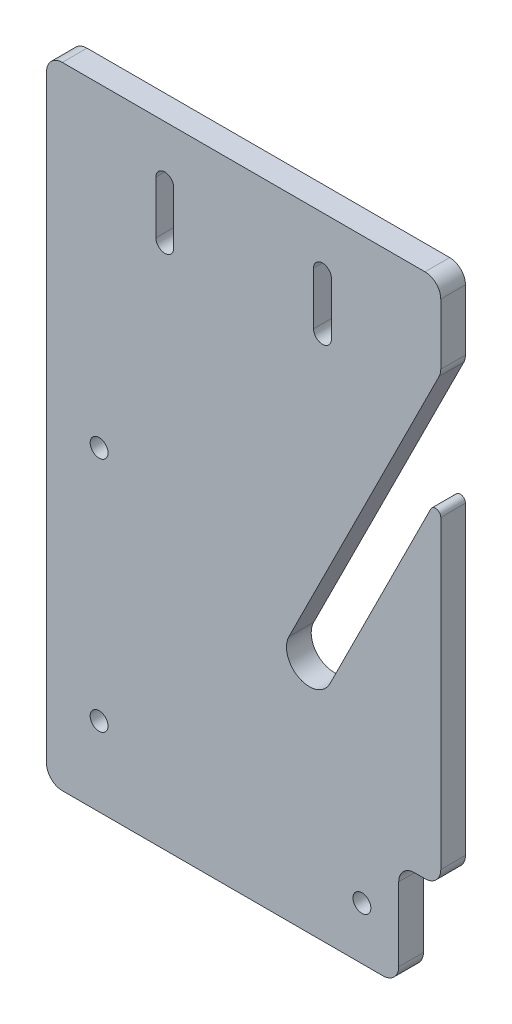
from build123d import *

# Parameters (mm, degrees)
SKETCH1_R           = 1.7
BOSS_EXTRUDE1_DEPTH = 4.7
FILLET1_R           = 3
CUT_EXTRUDE1_DEPTH  = 142.587746645
SKETCH3_W           = 8
SKETCH3_H           = 20
CUT_EXTRUDE2_DEPTH  = 142.587746645
FILLET2_R           = 3
FILLET3_R           = 1


with BuildPart() as part:
    # Sketch1 → Boss-Extrude1 (new body)
    with BuildSketch(Plane.XY):
        with BuildLine():
            Line((75, 0), (0, 0))
            Line((0, 0), (0, -120))
            Line((0, -120), (75, -120))
            Line((75, -120), (75, -34.726895702))
            Line((75, -34.726895702), (63.890758281, -56.94537914))
            Line((63.890758281, -56.94537914), (53.890758281, -76.94537914))
            ThreePointArc((53.890758281, -76.94537914), (48.05462086, -78.890758281), (46.109241719, -73.05462086))
            Line((46.109241719, -73.05462086), (56.109241719, -53.05462086))
            Line((56.109241719, -53.05462086), (75, -15.273104298))
            Line((75, -15.273104298), (75, 0))
        make_face()
        with Locations((10, -105)):
            Circle(SKETCH1_R, mode=Mode.SUBTRACT)
        with Locations((60, -110)):
            Circle(SKETCH1_R, mode=Mode.SUBTRACT)
        with Locations((10, -60)):
            Circle(SKETCH1_R, mode=Mode.SUBTRACT)
    extrude(amount=BOSS_EXTRUDE1_DEPTH)

    # Fillet1
    fillet1_edges = [part.edges().sort_by_distance(p)[0] for p in [
        (0, -120, 2.35),
        (75, -120, 2.35),
        (75, 0, 2.35),
        (0, 0, 2.35),
        (75, -15.273104298, 2.35),
    ]]
    fillet(fillet1_edges, radius=FILLET1_R)

    # Sketch2 → Cut-Extrude1 (cut, through all)
    with BuildSketch(Plane.XY.offset(4.7)):
        with BuildLine():
            Line((20.8, -10), (20.8, -20))
            ThreePointArc((20.8, -20), (22.5, -21.7), (24.2, -20))
            Line((24.2, -20), (24.2, -10))
            ThreePointArc((24.2, -10), (22.5, -8.3), (20.8, -10))
        make_face()
        with BuildLine():
            Line((50.8, -10), (50.8, -20))
            ThreePointArc((50.8, -20), (52.5, -21.7), (54.2, -20))
            Line((54.2, -20), (54.2, -10))
            ThreePointArc((54.2, -10), (52.5, -8.3), (50.8, -10))
        make_face()
    extrude(amount=-CUT_EXTRUDE1_DEPTH, mode=Mode.SUBTRACT)

    # Sketch3 → Cut-Extrude2 (cut, through all)
    with BuildSketch(Plane.XY.offset(4.7)):
        with Locations((71, -110)):
            Rectangle(SKETCH3_W, SKETCH3_H)
    extrude(amount=-CUT_EXTRUDE2_DEPTH, mode=Mode.SUBTRACT)

    # Fillet2
    fillet2_edges = [part.edges().sort_by_distance(p)[0] for p in [
        (75, -100, 2.35),
        (67, -100, 2.35),
        (67, -120, 2.35),
    ]]
    fillet(fillet2_edges, radius=FILLET2_R)

    # Fillet3
    fillet3_edges = [part.edges().sort_by_distance(p)[0] for p in [
        (75, -34.726895702, 2.35),
    ]]
    fillet(fillet3_edges, radius=FILLET3_R)


solid = part.part
